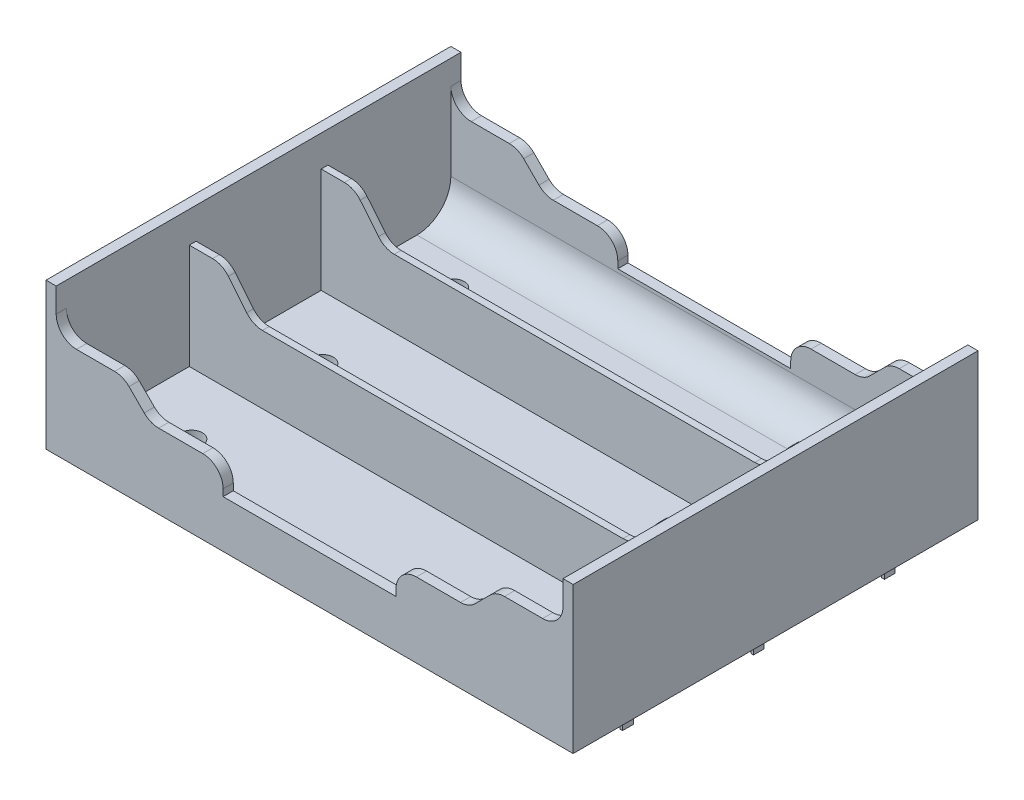
from build123d import *

# Parameters (mm, degrees)
SKETCH1_W                 = 77.724
SKETCH1_H                 = 59.69
BOSS_EXTRUDE1_DEPTH       = 21.59
SKETCH2_W                 = 0.4064
SKETCH2_H                 = 1.5748
BOSS_EXTRUDE2_DEPTH       = 3.175
SKETCH3_W                 = 0.4064
SKETCH3_H                 = 1.5748
BOSS_EXTRUDE3_DEPTH       = 3.175
SKETCH4_W                 = 0.4064
SKETCH4_H                 = 1.5748
BOSS_EXTRUDE4_DEPTH       = 3.175
SKETCH5_W                 = 0.4064
SKETCH5_H                 = 1.5748
BOSS_EXTRUDE5_DEPTH       = 3.175
SKETCH6_W                 = 0.4064
SKETCH6_H                 = 1.5748
BOSS_EXTRUDE6_DEPTH       = 3.175
SKETCH7_W                 = 0.4064
SKETCH7_H                 = 1.5748
BOSS_EXTRUDE7_DEPTH       = 3.175
F_4_CLEARANCE_HOLE1_D     = 3.2004
F_4_CLEARANCE_HOLE1_DEPTH = 5.08
SHELL1_START              = 1.5
SHELL1_OUTLINE_W          = 74.724
SHELL1_OUTLINE_H          = 56.69
SHELL1_OUTLINE_R          = 3.1002
SHELL1_DEPTH              = 20.09
SHELL1_START_2            = 6.58
SHELL1_2_OUTLINE_R        = 3.1002
SHELL1_2_DEPTH            = 15.01
FILLET1_R                 = 5
CUT_EXTRUDE3_DEPTH        = 75.426334345
SKETCH11_W                = 74.724
SKETCH11_H                = 46.69
CUT_EXTRUDE4_DEPTH        = 53.958353156
SKETCH12_W                = 74.724
SKETCH12_H                = 1
BOSS_EXTRUDE8_DEPTH       = 15.5
CUT_EXTRUDE5_REACH        = 61.182
FILLET2_R                 = 3
SKETCH14_R                = 1.905686258
CUT_EXTRUDE6_DEPTH        = 0.2
LPATTERN1_COUNT           = 3
LPATTERN1_PITCH           = 17.5


# Read off the part's stored shape, not the designer's step: Shell1
with BuildPart() as part:
    # Sketch1 → Boss-Extrude1 (new body)
    with BuildSketch(Plane.XZ):
        Rectangle(SKETCH1_W, SKETCH1_H)
    extrude(amount=-BOSS_EXTRUDE1_DEPTH)

    # Sketch2 → Boss-Extrude2 (add)
    with BuildSketch(Plane.XZ):
        with Locations((-36.195, 0)):
            Rectangle(SKETCH2_W, SKETCH2_H)
    extrude(amount=BOSS_EXTRUDE2_DEPTH)

    # Sketch3 → Boss-Extrude3 (add)
    with BuildSketch(Plane.XZ):
        with Locations((36.195, 0)):
            Rectangle(SKETCH3_W, SKETCH3_H)
    extrude(amount=BOSS_EXTRUDE3_DEPTH)

    # Sketch4 → Boss-Extrude4 (add)
    with BuildSketch(Plane.XZ):
        with Locations((-36.195, 19.304)):
            Rectangle(SKETCH4_W, SKETCH4_H)
    extrude(amount=BOSS_EXTRUDE4_DEPTH)

    # Sketch5 → Boss-Extrude5 (add)
    with BuildSketch(Plane.XZ):
        with Locations((36.195, 19.304)):
            Rectangle(SKETCH5_W, SKETCH5_H)
    extrude(amount=BOSS_EXTRUDE5_DEPTH)

    # Sketch6 → Boss-Extrude6 (add)
    with BuildSketch(Plane.XZ):
        with Locations((36.195, -19.304)):
            Rectangle(SKETCH6_W, SKETCH6_H)
    extrude(amount=BOSS_EXTRUDE6_DEPTH)

    # Sketch7 → Boss-Extrude7 (add)
    with BuildSketch(Plane.XZ):
        with Locations((-36.195, -19.304)):
            Rectangle(SKETCH7_W, SKETCH7_H)
    extrude(amount=BOSS_EXTRUDE7_DEPTH)

    # #4 Clearance Hole1
    with Locations(Plane(origin=(0, 0, 0), x_dir=(-1, 0, 0), z_dir=(0, -1, 0))):
        with Locations((27.94, 19.304), (27.94, 0), (-27.686, 19.304), (-27.686, 0), (-27.686, -19.304), (27.94, -19.304)):
            Hole(F_4_CLEARANCE_HOLE1_D / 2, depth=F_4_CLEARANCE_HOLE1_DEPTH)

    # Shell1 outline → Shell1 (cut)
    with BuildSketch(Plane(origin=(0, 0, 0), x_dir=(1, 0, 0), z_dir=(0, 1, 0)).offset(SHELL1_START)):
        Rectangle(SHELL1_OUTLINE_W, SHELL1_OUTLINE_H)
        with Locations((-27.94, -19.304)):
            Circle(SHELL1_OUTLINE_R, mode=Mode.SUBTRACT)
        with Locations((-27.94, 0)):
            Circle(SHELL1_OUTLINE_R, mode=Mode.SUBTRACT)
        with Locations((27.686, -19.304)):
            Circle(SHELL1_OUTLINE_R, mode=Mode.SUBTRACT)
        with Locations((27.686, 0)):
            Circle(SHELL1_OUTLINE_R, mode=Mode.SUBTRACT)
        with Locations((-27.94, 19.304)):
            Circle(SHELL1_OUTLINE_R, mode=Mode.SUBTRACT)
        with Locations((27.686, 19.304)):
            Circle(SHELL1_OUTLINE_R, mode=Mode.SUBTRACT)
    extrude(amount=SHELL1_DEPTH, mode=Mode.SUBTRACT)

    # Shell1 2 outline → Shell1 2 (cut)
    with BuildSketch(Plane(origin=(0, 0, 0), x_dir=(1, 0, 0), z_dir=(0, 1, 0)).offset(SHELL1_START_2)):
        with Locations((-27.94, -19.304)):
            Circle(SHELL1_2_OUTLINE_R)
        with Locations((27.686, -19.304)):
            Circle(SHELL1_2_OUTLINE_R)
        with Locations((27.686, 0)):
            Circle(SHELL1_2_OUTLINE_R)
        with Locations((27.686, 19.304)):
            Circle(SHELL1_2_OUTLINE_R)
        with Locations((-27.94, 0)):
            Circle(SHELL1_2_OUTLINE_R)
        with Locations((-27.94, 19.304)):
            Circle(SHELL1_2_OUTLINE_R)
    extrude(amount=SHELL1_2_DEPTH, mode=Mode.SUBTRACT)

    # Fillet1
    fillet1_edges = [part.edges().sort_by_distance(p)[0] for p in [
        (0, 1.5, 28.345),
        (0, 1.5, -28.345),
    ]]
    fillet(fillet1_edges, radius=FILLET1_R)

    # Sketch10 → Cut-Extrude3 (cut, through all)
    with BuildSketch(Plane(origin=(0, 0, -29.845), x_dir=(-1, 0, 0), z_dir=(0, 0, -1))):
        Polygon((0, 7), (12.75, 7), (12.75, 11), (23.5, 11), (27.5, 15), (37.362, 15), (37.362, 21.59), (0, 21.59), align=None)
    cut_extrude3 = extrude(amount=-CUT_EXTRUDE3_DEPTH, mode=Mode.SUBTRACT)

    # Mirror1: Cut-Extrude3 across plane
    add(cut_extrude3.mirror(Plane(origin=(0, 0, 0), x_dir=(0, 0, 1), z_dir=(1, 0, 0))), mode=Mode.SUBTRACT)

    # Sketch11 → Cut-Extrude4 (cut, through all)
    with BuildSketch(Plane(origin=(0, 1.5, 0), x_dir=(1, 0, 0), z_dir=(0, 1, 0))):
        Rectangle(SKETCH11_W, SKETCH11_H)
    extrude(amount=CUT_EXTRUDE4_DEPTH, mode=Mode.SUBTRACT)

    # Sketch12 → Boss-Extrude8 (add)
    with BuildSketch(Plane(origin=(0, 1.5, 0), x_dir=(1, 0, 0), z_dir=(0, 1, 0))):
        with Locations((0, 9.72)):
            Rectangle(SKETCH12_W, SKETCH12_H)
    boss_extrude8 = extrude(amount=BOSS_EXTRUDE8_DEPTH)

    # Sketch13 → Cut-Extrude5 (cut, up to next)
    with BuildSketch(Plane.XY.offset(-9.22), mode=Mode.PRIVATE) as cut_extrude5_sk1:
        Polygon((-32.5, 17), (-28, 11.5), (28, 11.5), (32.5, 17), align=None)
    cut_extrude5_tool1 = extrude(cut_extrude5_sk1.sketch, amount=-CUT_EXTRUDE5_REACH, mode=Mode.PRIVATE) & part.part
    cut_extrude5 = cut_extrude5_tool1.solids().sort_by_distance((0, 14.318182, -9.22))[0]
    add(cut_extrude5, mode=Mode.SUBTRACT)

    # Mirror2: Boss-Extrude8, Cut-Extrude5 across plane
    add(boss_extrude8.mirror(Plane.XY))
    add(cut_extrude5.mirror(Plane.XY), mode=Mode.SUBTRACT)

    # Fillet2
    fillet2_edges = [part.edges().sort_by_distance(p)[0] for p in [
        (-27.5, 15, 29.095),
        (-27.5, 15, -29.095),
        (-23.5, 11, 29.095),
        (-23.5, 11, -29.095),
        (-12.75, 11, 29.095),
        (-12.75, 11, -29.095),
        (-37.362, 15, 29.095),
        (-37.362, 15, -29.095),
        (12.75, 11, 29.095),
        (12.75, 11, -29.095),
        (23.5, 11, 29.095),
        (23.5, 11, -29.095),
        (37.362, 15, 29.095),
        (37.362, 15, -29.095),
        (27.5, 15, 29.095),
        (27.5, 15, -29.095),
        (-32.5, 17, -9.72),
        (32.5, 17, -9.72),
        (28, 11.5, -9.72),
        (-28, 11.5, -9.72),
        (32.5, 17, 9.72),
        (-32.5, 17, 9.72),
        (-28, 11.5, 9.72),
        (28, 11.5, 9.72),
    ]]
    fillet(fillet2_edges, radius=FILLET2_R)

    # Sketch14 → Cut-Extrude6 (cut)
    with BuildSketch(Plane(origin=(0, 1.5, 0), x_dir=(1, 0, 0), z_dir=(0, 1, 0))):
        with Locations(Location((21.159931599, 16.535374869, 0), (0, 0, 270))):
            Circle(SKETCH14_R)
        Polygon((20.972468472, 16.692908218), (20.972468472, 17.7249595), (21.286571036, 17.7249595), (21.286571036, 16.692908218), (22.318622318, 16.692908218), (22.318622318, 16.378805654), (21.286571036, 16.378805654), (21.286571036, 15.346754372), (20.972468472, 15.346754372), (20.972468472, 16.378805654), (19.94041719, 16.378805654), (19.94041719, 16.692908218), align=None, mode=Mode.SUBTRACT)
    cut_extrude6 = extrude(amount=-CUT_EXTRUDE6_DEPTH, mode=Mode.SUBTRACT)

    # LPattern1: Cut-Extrude6 ×3
    with Locations(*[(0, 0, i * LPATTERN1_PITCH) for i in range(1, LPATTERN1_COUNT)]):
        add(cut_extrude6, mode=Mode.SUBTRACT)


solid = part.part
